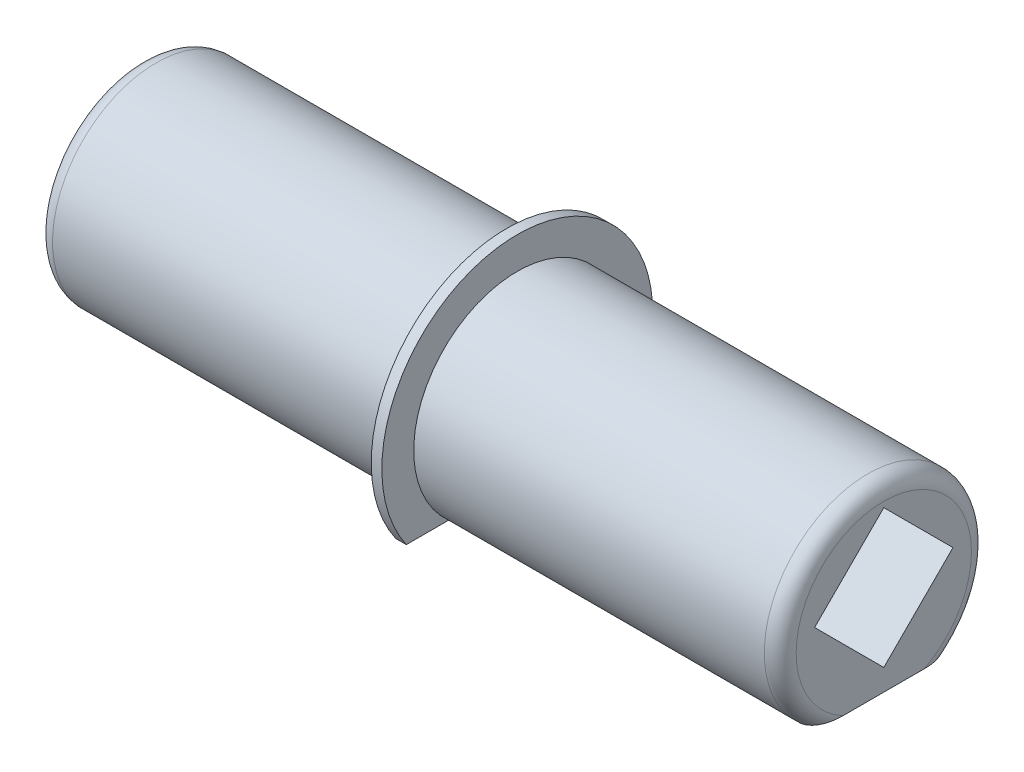
from build123d import *

# Parameters (mm, degrees)
BOSS_EXTRU_1_DEPTH      = 35
BOSS_EXTRU_2_DEPTH      = 0.5
ENL_V_MAT_EXTRU_1_DEPTH = 50
CONG_1_R                = 1.5


with BuildPart() as part:
    # Esquisse1 → Boss.-Extru.1 (new, symmetric)
    with BuildSketch(Plane(origin=(0, 0, 0), x_dir=(0, 0, -1), z_dir=(1, 0, 0))):
        with BuildLine():
            Line((-6.450810962, -7.31091909), (6.450810962, -7.31091909))
            ThreePointArc((6.450810962, -7.31091909), (0, 9.75), (-6.450810962, -7.31091909))
        make_face()
    extrude(amount=BOSS_EXTRU_1_DEPTH, both=True)

    # Esquisse3 → Boss.-Extru.2 (add, symmetric)
    with BuildSketch(Plane(origin=(0, 0, 0), x_dir=(0, 0, -1), z_dir=(1, 0, 0))):
        with BuildLine():
            Line((-10.44571501, -7.31091909), (10.44571501, -7.31091909))
            ThreePointArc((10.44571501, -7.31091909), (0, 12.75), (-10.44571501, -7.31091909))
        make_face()
    extrude(amount=BOSS_EXTRU_2_DEPTH, both=True)

    # Esquisse2 → Enlèv. mat.-Extru.1 (cut, symmetric)
    with BuildSketch(Plane(origin=(0, 0, 0), x_dir=(0, 0, -1), z_dir=(1, 0, 0))):
        Polygon((-6.513440431, 1.219540455), (0, -5.293899976), (6.513440431, 1.219540455), (0, 7.732980886), align=None)
    extrude(amount=ENL_V_MAT_EXTRU_1_DEPTH, both=True, mode=Mode.SUBTRACT)

    # Congé1
    cong_1_edges = [part.edges().sort_by_distance(p)[0] for p in [
        (-35, 9.75, 0),
        (35, 9.75, 0),
    ]]
    fillet(cong_1_edges, radius=CONG_1_R)


solid = part.part
